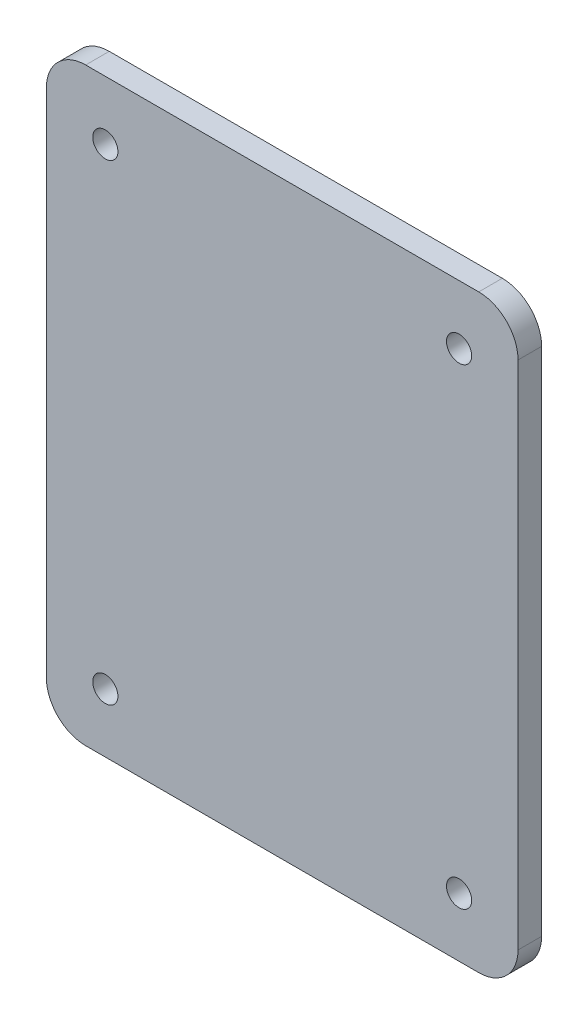
from build123d import *

# Parameters (mm, degrees)
SKETCH_2_W      = 60
SKETCH_2_H      = 75
SKETCH_2_R      = 1.6
EXTRUDE_1_DEPTH = 3
FILLET_1_R      = 5


with BuildPart() as part:
    # ｽｹｯﾁ2 → ﾎﾞｽ - 押し出し1 (new body)
    with BuildSketch(Plane.XY):
        with Locations((30, -37.5)):
            Rectangle(SKETCH_2_W, SKETCH_2_H)
        with Locations((7.5, -7.5)):
            Circle(SKETCH_2_R, mode=Mode.SUBTRACT)
        with Locations((52.5, -7.5)):
            Circle(SKETCH_2_R, mode=Mode.SUBTRACT)
        with Locations((7.5, -67.5)):
            Circle(SKETCH_2_R, mode=Mode.SUBTRACT)
        with Locations((52.5, -67.5)):
            Circle(SKETCH_2_R, mode=Mode.SUBTRACT)
    extrude(amount=EXTRUDE_1_DEPTH)

    # ﾌｨﾚｯﾄ1
    fillet_1_edges = [part.edges().sort_by_distance(p)[0] for p in [
        (0, -75, 1.5),
        (0, 0, 1.5),
        (60, -75, 1.5),
        (60, 0, 1.5),
    ]]
    fillet(fillet_1_edges, radius=FILLET_1_R)


solid = part.part
